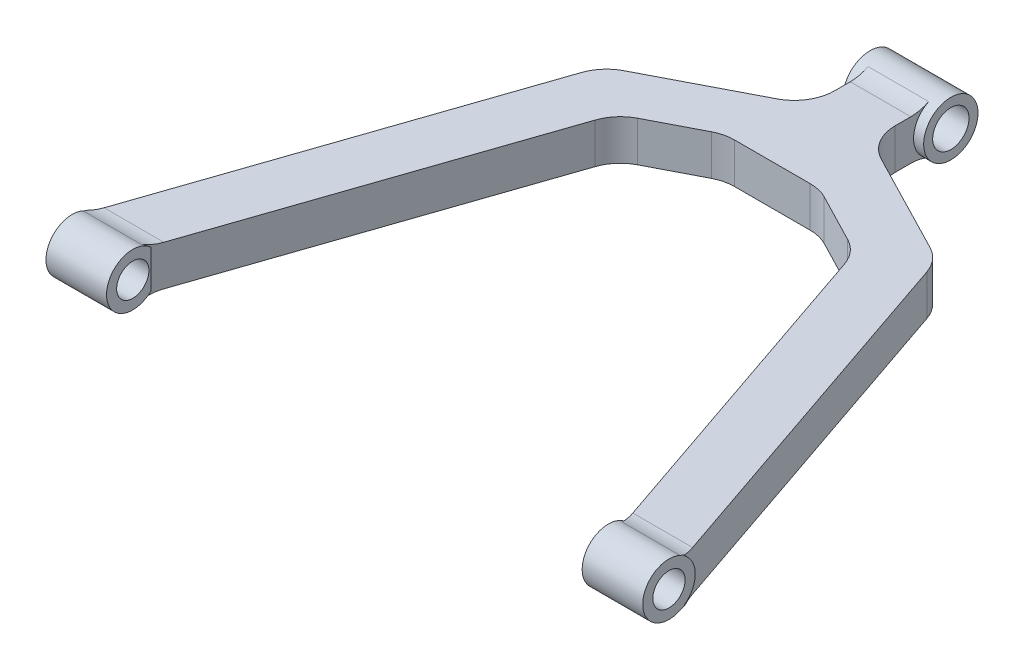
from build123d import *

# Parameters (mm, degrees)
BOSS_EXTRUDE1_DEPTH      = 10
SKETCH3_R                = 6.5
SKETCH3_R_2              = 4
BOSS_EXTRUDE3_DEPTH      = 7.5
SKETCH7_W                = 15
SKETCH7_H                = 12.050233058
BOSS_EXTRUDE4_DEPTH      = 10
BOSS_EXTRUDE5_DEPTH      = 10
BOSS_EXTRUDE5_DEPTH_BACK = 10
SKETCH9_R                = 6.726812024
SKETCH9_R_2              = 4.5
FILLET1_R                = 10
FILLET2_R                = 10
FILLET3_R                = 10
FILLET4_R                = 10


with BuildPart() as part:
    # Sketch1 → Boss-Extrude1 (new body)
    with BuildSketch(Plane(origin=(0, 0, 0), x_dir=(1, 0, 0), z_dir=(0, 1, 0))):
        Polygon((-11.814153955, -17.668422436), (-29.581045004, -26.851971991), (-59, -113), (-73.793817424, -113), (-41.477337097, -18.36709911), (-5.943554998, 0), (5.943554998, 0), (41.477337097, -18.36709911), (73.793817424, -113), (59, -113), (29.581045004, -26.851971991), (11.814153955, -17.668422436), align=None)
    extrude(amount=BOSS_EXTRUDE1_DEPTH)

    # Sketch3 → Boss-Extrude3 (add, symmetric)
    with BuildSketch(Plane(origin=(-66.396908712, 0, 0), x_dir=(0, 0, -1), z_dir=(1, 0, 0))):
        with Locations((-117.153311931, 5)):
            Circle(SKETCH3_R)
        with Locations((-117.153311931, 5)):
            Circle(SKETCH3_R_2, mode=Mode.SUBTRACT)
    boss_extrude3 = extrude(amount=BOSS_EXTRUDE3_DEPTH, both=True)

    # Mirror3: Boss-Extrude3 across plane
    add(boss_extrude3.mirror(Plane(origin=(0, 0, 0), x_dir=(0, 0, 1), z_dir=(1, 0, 0))))

    # Sketch7 → Boss-Extrude4 (add)
    with BuildSketch(Plane(origin=(0, 10, 0), x_dir=(1, 0, 0), z_dir=(0, 1, 0))):
        with Locations((0, 6.025116529)):
            Rectangle(SKETCH7_W, SKETCH7_H)
    extrude(amount=-BOSS_EXTRUDE4_DEPTH)

    # Sketch9 → Boss-Extrude5 (add, two sides: drawn at the far end of the back side and taken through both)
    with BuildSketch(Plane(origin=(0, 0, 0), x_dir=(0, 0, -1), z_dir=(1, 0, 0)).offset(-BOSS_EXTRUDE5_DEPTH_BACK)):
        with Locations((16.550233058, 5)):
            Circle(SKETCH9_R)
        with Locations((16.550233058, 5)):
            Circle(SKETCH9_R_2, mode=Mode.SUBTRACT)
    extrude(amount=BOSS_EXTRUDE5_DEPTH + BOSS_EXTRUDE5_DEPTH_BACK)

    # Fillet1
    # the kernel refuses this fillet: 10 mm, written as the material it adds along each edge
    with BuildSketch(Plane(origin=(-5.943554998, 0, 0), x_dir=(-0.88834455248328, 0, 0.4591774777504672), z_dir=(0, 1, 0))) as fillet1_piece_1:
        with BuildLine():
            CenterArc((5.095194407, -10), FILLET1_R, 90, 21.792944461)
            Line((1.382659439, -0.71468449), (0, 0))
            Line((0, 0), (5.095194407, 0))
        make_face()
    extrude(amount=10)

    # Fillet2
    # the kernel refuses this fillet: 10 mm, written as the material it adds along each edge
    with BuildSketch(Plane(origin=(5.943554998, 0, 0), x_dir=(0.8883445524832799, 0, 0.4591774777504676), z_dir=(0, 1, 0))) as fillet2_piece_1:
        with BuildLine():
            CenterArc((5.095194407, 10), FILLET2_R, 248.207055539, 21.792944461)
            Line((1.382659439, 0.71468449), (0, 0))
            Line((0, 0), (5.095194407, 0))
        make_face()
    extrude(amount=10)

    # Fillet3
    # the kernel refuses this fillet: 10 mm, written as the material it adds along each edge
    with BuildSketch(Plane(origin=(11.814153955, 0, 17.668422436), x_dir=(0.8883445524832799, 0, 0.4591774777504676), z_dir=(0, 1, 0)), Plane(origin=(-11.814153955, 0, 17.668422436), x_dir=(1, 0, 0), z_dir=(0, 1, 0))) as fillet3_piece_1:
        with BuildLine():
            CenterArc((FILLET3_R * 0.243164033357, -FILLET3_R), FILLET3_R, 90, 27.334044372)
            Line((-FILLET3_R * 0.216013444393, -FILLET3_R * 0.111655447517), (0, 0))
            Line((0, 0), (FILLET3_R * 0.243164033357, 0))
        make_face()
    extrude(amount=10)
    with BuildSketch(Plane(origin=(29.581045004, 0, 26.851971991), x_dir=(0.3231689910588884, 0, 0.946341272067313), z_dir=(0, 1, 0)), Plane(origin=(-29.581045004, 0, 26.851971991), x_dir=(0.8883445524832806, 0, -0.4591774777504663), z_dir=(0, 1, 0))) as fillet3_piece_2:
        with BuildLine():
            CenterArc((FILLET3_R * 0.402111719604, -FILLET3_R), FILLET3_R, 90, 43.811274916)
            Line((-FILLET3_R * 0.290173472026, -FILLET3_R * 0.278375988862), (0, 0))
            Line((0, 0), (FILLET3_R * 0.402111719604, 0))
        make_face()
    extrude(amount=10)
    with BuildSketch(Plane(origin=(-52.198620973, 10, 113), x_dir=(0, 0, -1), z_dir=(-1, 0, 0))) as fillet3_piece_3_section:
        with BuildLine():
            CenterArc((2.720551611, -10), FILLET3_R, 90, 24.619977329)
            ThreePointArc((-1.445426294, -0.909090909), (-0.692731114, -0.502215954), (0, 0))
            Line((0, 0), (2.720551611, 0))
        make_face()
    fillet3_piece_3 = extrude(amount=28.396575479, mode=Mode.PRIVATE)
    fillet3_piece_3 = split(fillet3_piece_3, bisect_by=Plane(origin=(-58.289676239, 10, 110.919946807), z_dir=(-0.9463412720673133, 0, -0.3231689910588876)), keep=Keep.TOP, mode=Mode.PRIVATE)
    fillet3_piece_3 = split(fillet3_piece_3, bisect_by=Plane(origin=(-71.538454048, 10, 106.395580932), z_dir=(0.9463412720673133, 0, 0.3231689910588875)), keep=Keep.TOP, mode=Mode.PRIVATE)
    fillet3_piece_3 = split(fillet3_piece_3, bisect_by=Plane(origin=(-73.896908712, 10, 113), z_dir=(1, 0, 0)), keep=Keep.TOP, mode=Mode.PRIVATE)
    add(fillet3_piece_3)
    with BuildSketch(Plane(origin=(80.595196452, 10, 113), x_dir=(0, 0, -1), z_dir=(-1, 0, 0))) as fillet3_piece_4_section:
        with BuildLine():
            CenterArc((2.720551611, -10), FILLET3_R, 90, 24.619977329)
            ThreePointArc((-1.445426294, -0.909090909), (-0.692731114, -0.502215954), (0, 0))
            Line((0, 0), (2.720551611, 0))
        make_face()
    fillet3_piece_4 = extrude(amount=28.396575479, mode=Mode.PRIVATE)
    fillet3_piece_4 = split(fillet3_piece_4, bisect_by=Plane(origin=(74.504141186, 10, 115.080053193), z_dir=(-0.9463412720673132, 0, 0.32316899105888797)), keep=Keep.TOP, mode=Mode.PRIVATE)
    fillet3_piece_4 = split(fillet3_piece_4, bisect_by=Plane(origin=(61.255363377, 10, 119.604419068), z_dir=(0.9463412720673132, 0, -0.32316899105888797)), keep=Keep.TOP, mode=Mode.PRIVATE)
    fillet3_piece_4 = split(fillet3_piece_4, bisect_by=Plane(origin=(73.896908712, 10, 113), z_dir=(-1, 0, 0)), keep=Keep.TOP, mode=Mode.PRIVATE)
    add(fillet3_piece_4)
    with BuildSketch(Plane(origin=(80.595196452, 0, 113), x_dir=(0, 0, -1), z_dir=(-1, 0, 0))) as fillet3_piece_5_section:
        with BuildLine():
            CenterArc((2.720551611, 10), FILLET3_R, 245.380022671, 24.619977329)
            ThreePointArc((-1.445426294, 0.909090909), (-0.692731114, 0.502215954), (0, 0))
            Line((0, 0), (2.720551611, 0))
        make_face()
    fillet3_piece_5 = extrude(amount=28.396575479, mode=Mode.PRIVATE)
    fillet3_piece_5 = split(fillet3_piece_5, bisect_by=Plane(origin=(74.504141186, 0, 115.080053193), z_dir=(-0.9463412720673132, 0, 0.32316899105888797)), keep=Keep.TOP, mode=Mode.PRIVATE)
    fillet3_piece_5 = split(fillet3_piece_5, bisect_by=Plane(origin=(61.255363377, 0, 119.604419068), z_dir=(0.9463412720673132, 0, -0.32316899105888797)), keep=Keep.TOP, mode=Mode.PRIVATE)
    fillet3_piece_5 = split(fillet3_piece_5, bisect_by=Plane(origin=(73.896908712, 0, 113), z_dir=(-1, 0, 0)), keep=Keep.TOP, mode=Mode.PRIVATE)
    add(fillet3_piece_5)
    with BuildSketch(Plane(origin=(-52.198620973, 0, 113), x_dir=(0, 0, -1), z_dir=(-1, 0, 0))) as fillet3_piece_6_section:
        with BuildLine():
            CenterArc((2.720551611, 10), FILLET3_R, 245.380022671, 24.619977329)
            ThreePointArc((-1.445426294, 0.909090909), (-0.692731114, 0.502215954), (0, 0))
            Line((0, 0), (2.720551611, 0))
        make_face()
    fillet3_piece_6 = extrude(amount=28.396575479, mode=Mode.PRIVATE)
    fillet3_piece_6 = split(fillet3_piece_6, bisect_by=Plane(origin=(-58.289676239, 0, 110.919946807), z_dir=(-0.9463412720673133, 0, -0.3231689910588876)), keep=Keep.TOP, mode=Mode.PRIVATE)
    fillet3_piece_6 = split(fillet3_piece_6, bisect_by=Plane(origin=(-71.538454048, 0, 106.395580932), z_dir=(0.9463412720673133, 0, 0.3231689910588875)), keep=Keep.TOP, mode=Mode.PRIVATE)
    fillet3_piece_6 = split(fillet3_piece_6, bisect_by=Plane(origin=(-73.896908712, 0, 113), z_dir=(1, 0, 0)), keep=Keep.TOP, mode=Mode.PRIVATE)
    add(fillet3_piece_6)
    with BuildSketch(Plane(origin=(-7.5, 10, 0), x_dir=(-0.8324412912652444, 0, 0.5541132525004725), z_dir=(0, -1, 0))) as fillet3_piece_7:
        with BuildLine():
            CenterArc((5.396772828, 9.93931012), FILLET3_R, 213.649659515, 62.665955628)
            Line((-2.927640085, 4.398177595), (-3.760081376, 3.844064343))
            Line((-3.760081376, 3.844064343), (-0.832441291, -0.554113253))
            Line((-0.832441291, -0.554113253), (-0.266857068, -0.963736118))
            ThreePointArc((-0.266857068, -0.963736118), (3.878627843, -1.295879951), (6.606829993, -0.993931012))
            Line((6.606829993, -0.993931012), (6.496824796, 0))
        make_face()
    extrude(amount=10)
    with BuildSketch(Plane(origin=(7.5, 10, 0), x_dir=(0.832441291265244, 0, 0.5541132525004732), z_dir=(0, -1, 0))) as fillet3_piece_8:
        with BuildLine():
            CenterArc((5.396772828, -9.93931012), FILLET3_R, 83.684384857, 62.665955628)
            Line((-2.927640085, -4.398177595), (-3.760081376, -3.844064343))
            Line((-3.760081376, -3.844064343), (-0.832441291, 0.554113253))
            Line((-0.832441291, 0.554113253), (-0.266857068, 0.963736118))
            ThreePointArc((-0.266857068, 0.963736118), (3.878627843, 1.295879951), (6.606829993, 0.993931012))
            Line((6.606829993, 0.993931012), (6.496824796, 0))
        make_face()
    extrude(amount=10)
    # the kernel refuses this fillet: 10 mm, written as the material it takes off along each edge
    with BuildSketch(Plane(origin=(41.477337097, -10.05279299, 18.36709911), x_dir=(0.3231689910588881, 0, 0.9463412720673132), z_dir=(0, 1, 0)), Plane(origin=(-41.477337097, -10.05279299, 18.36709911), x_dir=(0.8883445524832805, 0, -0.4591774777504667), z_dir=(0, 1, 0))) as fillet3_2_piece_1:
        with BuildLine():
            CenterArc((FILLET3_R * 0.402111719604, -FILLET3_R), FILLET3_R, 90, 43.811274916)
            Line((-FILLET3_R * 0.290173472026, -FILLET3_R * 0.278375988862), (0, 0))
            Line((0, 0), (FILLET3_R * 0.402111719604, 0))
        make_face()
    extrude(amount=30.10558598, mode=Mode.SUBTRACT)

    # Fillet4
    fillet4_edges = [part.edges().sort_by_distance(p)[0] for p in [
        (0, 10, -12.050233058),
        (0, 0, -12.050233058),
    ]]
    fillet(fillet4_edges, radius=FILLET4_R)


solid = part.part
